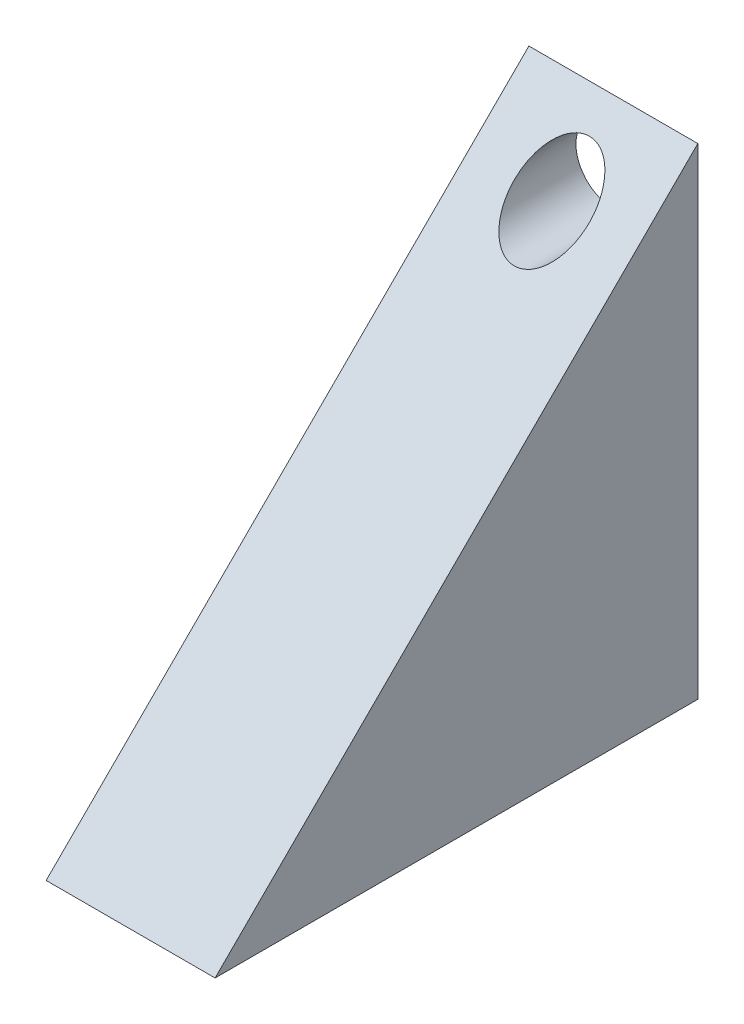
from build123d import *

# Parameters (mm, degrees)
BOSS_EXTRUDE2_DEPTH = 7
SKETCH4_R           = 1.55
CUT_EXTRUDE1_DEPTH  = 26.117943959


with BuildPart() as part:
    # Sketch2 → Boss-Extrude2 (new body)
    with BuildSketch(Plane(origin=(0, 0, 0), x_dir=(0, 0, -1), z_dir=(1, 0, 0))):
        Polygon((-4.143812535, -6.451557369), (15.856187465, -6.451557369), (15.856187465, 13.487442631), align=None)
    extrude(amount=BOSS_EXTRUDE2_DEPTH)

    # Sketch4 → Cut-Extrude1 (cut, through all)
    with BuildSketch(Plane(origin=(0, 0, -15.856187465), x_dir=(-1, 0, 0), z_dir=(0, 0, -1))):
        with Locations((-3.5, 10.947442631)):
            Circle(SKETCH4_R)
    extrude(amount=-CUT_EXTRUDE1_DEPTH, mode=Mode.SUBTRACT)


solid = part.part
